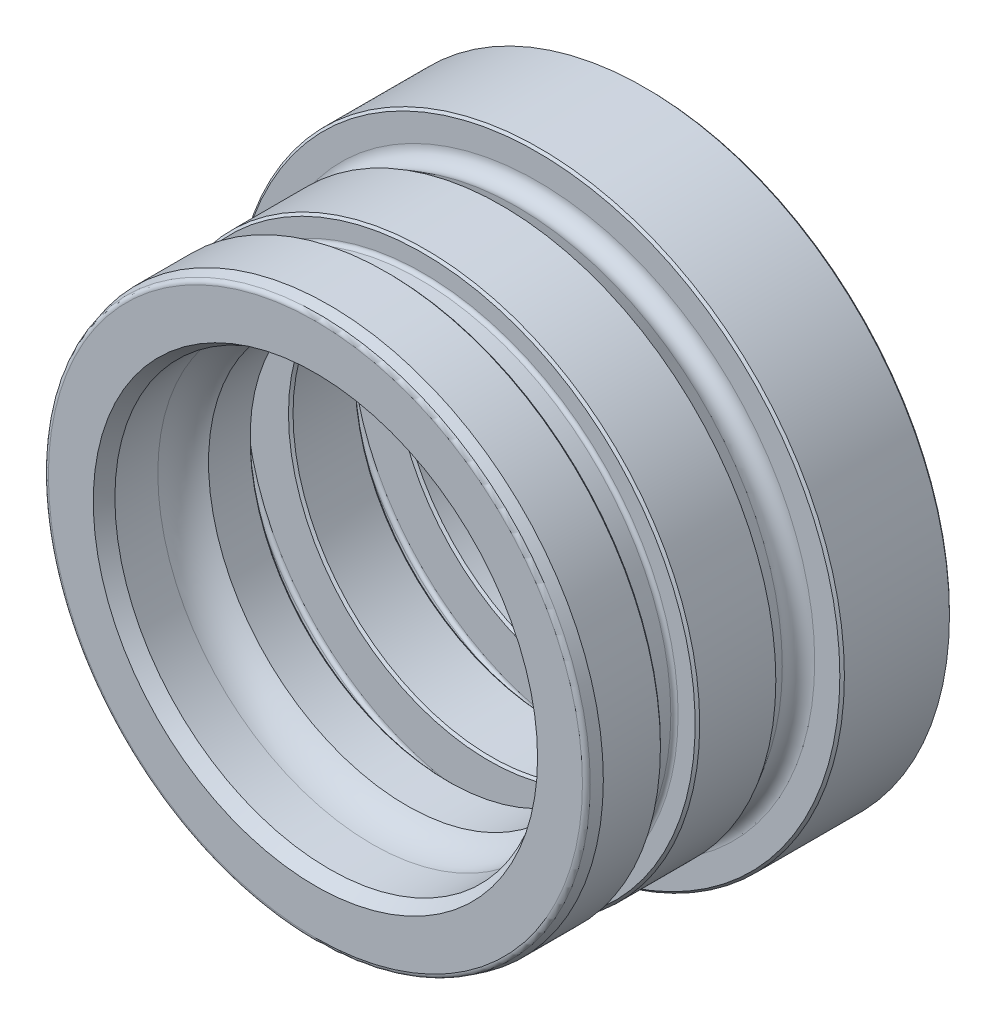
from build123d import *

# Parameters (mm, degrees)
CHAMFER1_SIZE = 0.25


with BuildPart() as part:
    # Sketch1 → Revolve1 (revolve)
    with BuildSketch(Plane(origin=(0, 0, 0), x_dir=(0, 0, -1), z_dir=(1, 0, 0))):
        with BuildLine():
            Line((0, 29.229412717), (0, 24.316025404))
            Line((0, 24.316025404), (1.5, 23.45))
            Line((1.5, 23.45), (6.200328962, 23.45))
            ThreePointArc((6.200328962, 23.45), (8.291979028, 22.991475531), (10, 21.7))
            Line((10, 21.7), (14.8, 21.7))
            Line((14.8, 21.7), (14.8, 26.6))
            ThreePointArc((14.8, 26.6), (14.917157288, 26.882842712), (15.2, 27))
            Line((15.2, 27), (18.6, 27))
            ThreePointArc((18.6, 27), (18.882842712, 26.882842712), (19, 26.6))
            Line((19, 26.6), (19, 21.7))
            Line((19, 21.7), (26.3, 21.7))
            Line((26.3, 21.7), (26.3, 26.6))
            ThreePointArc((26.3, 26.6), (26.417157288, 26.882842712), (26.7, 27))
            Line((26.7, 27), (30.1, 27))
            ThreePointArc((30.1, 27), (30.382842712, 26.882842712), (30.5, 26.6))
            Line((30.5, 26.6), (30.5, 21.7))
            Line((30.5, 21.7), (35.8, 21.7))
            Line((35.8, 21.7), (36.3, 22.2))
            Line((36.3, 22.2), (36.3, 33.1))
            Line((36.3, 33.1), (36.05, 33.35))
            Line((36.05, 33.35), (24.3, 33.35))
            Line((24.3, 33.35), (24.3, 30.35))
            ThreePointArc((24.3, 30.35), (23.55, 29.050961894), (22.05, 29.050961894))
            Line((22.05, 29.050961894), (20.380237021, 30.015))
            Line((20.380237021, 30.015), (11.8, 30.015))
            Line((11.8, 30.015), (11.8, 27.9))
            ThreePointArc((11.8, 27.9), (11.682842712, 27.617157288), (11.4, 27.5))
            Line((11.4, 27.5), (8.4, 27.5))
            ThreePointArc((8.4, 27.5), (8.117157288, 27.617157288), (8, 27.9))
            Line((8, 27.9), (8, 30.015))
            Line((8, 30.015), (1.5, 30.015))
            Line((1.5, 30.015), (0.370590477, 29.712375631))
            ThreePointArc((0.370590477, 29.712375631), (0.10332333, 29.533793432), (0, 29.229412717))
        make_face()
    revolve(axis=Axis((0, 0, 32.950954669), (0, 0, -1)))

    # Chamfer1
    chamfer1_edges = [part.edges().sort_by_distance(p)[0] for p in [
        (0, -33.35, -24.3),
        (0, -30.015, -8),
        (0, -30.015, -11.8),
        (0, -21.7, -19),
        (0, -21.7, -14.8),
        (0, -21.7, -26.3),
        (0, -21.7, -30.5),
    ]]
    chamfer(chamfer1_edges, length=CHAMFER1_SIZE)


solid = part.part
